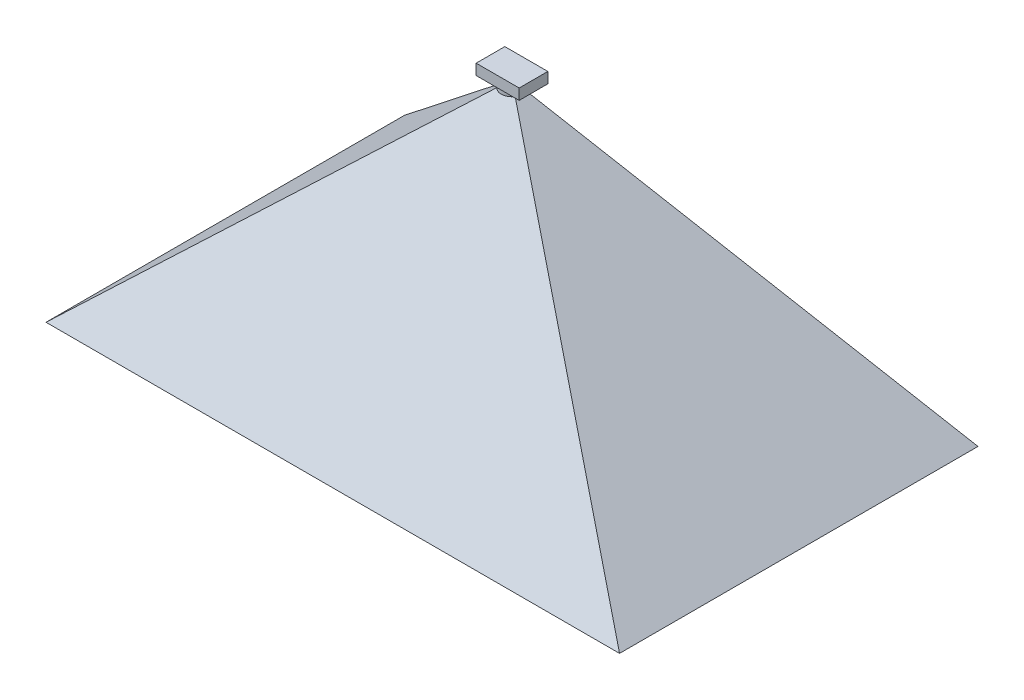
from build123d import *

# Parameters (mm, degrees)
SKETCH3_R           = 3.81
CAMERA_LENS_DEPTH   = 2.54
SKETCH4_W           = 15.24
SKETCH4_H           = 10.16
CAMERA_HOLDER_DEPTH = 3.81


with BuildPart() as part:
    # Sketch2 → FOV section 0
    with BuildSketch(Plane(origin=(0, 90.932, 0), x_dir=(1, 0, 0), z_dir=(0, 1, 0))):
        with BuildLine():
            Line((-2.755394972, -1.722121857), (2.755394972, -1.722121857))
            Line((2.755394972, -1.722121857), (2.755394972, 1.722121857))
            Line((2.755394972, 1.722121857), (-2.755394972, 1.722121857))
            Line((-2.755394972, 1.722121857), (-2.755394972, -1.722121857))
        make_face()
    # Sketch1 → FOV section 1
    with BuildSketch(Plane(origin=(0, 0, 0), x_dir=(1, 0, 0), z_dir=(0, 1, 0))):
        with BuildLine():
            Line((-101.6, -63.5), (101.6, -63.5))
            Line((101.6, -63.5), (101.6, 63.5))
            Line((101.6, 63.5), (-101.6, 63.5))
            Line((-101.6, 63.5), (-101.6, -63.5))
        make_face()
    loft()

    # Sketch3 → camera lens (add)
    with BuildSketch(Plane(origin=(0, 90.932, 0), x_dir=(1, 0, 0), z_dir=(0, 1, 0))):
        Circle(SKETCH3_R)
    extrude(amount=CAMERA_LENS_DEPTH)

    # Sketch4 → camera holder (add)
    with BuildSketch(Plane(origin=(0, 93.472, 0), x_dir=(1, 0, 0), z_dir=(0, 1, 0))):
        Rectangle(SKETCH4_W, SKETCH4_H)
    extrude(amount=CAMERA_HOLDER_DEPTH)


solid = part.part
